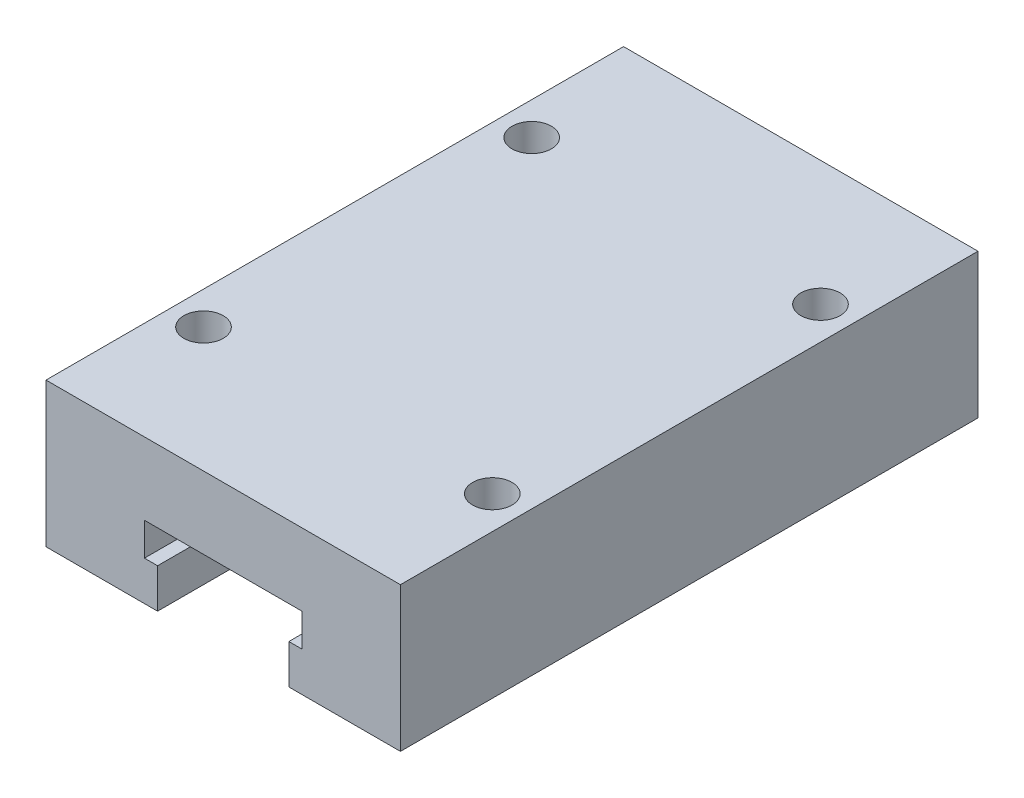
from build123d import *

# Parameters (mm, degrees)
BOSS_EXTRUDE1_DEPTH = 44
SKETCH2_R           = 1.5
CUT_EXTRUDE1_DEPTH  = 4


with BuildPart() as part:
    # Sketch1 → Boss-Extrude1 (new body)
    with BuildSketch(Plane.XY):
        Polygon((19.5, 5.5), (19.5, 3), (18.5, 3), (18.5, 0), (27, 0), (27, 11), (0, 11), (0, 0), (8.5, 0), (8.5, 3), (7.5, 3), (7.5, 5.5), align=None)
    extrude(amount=BOSS_EXTRUDE1_DEPTH)

    # Sketch2 → Cut-Extrude1 (cut)
    with BuildSketch(Plane(origin=(0, 11, 0), x_dir=(1, 0, 0), z_dir=(0, 1, 0))):
        with Locations((2.5, -9.5)):
            Circle(SKETCH2_R)
        with Locations((24.5, -9.5)):
            Circle(SKETCH2_R)
        with Locations((24.5, -34.5)):
            Circle(SKETCH2_R)
        with Locations((2.5, -34.5)):
            Circle(SKETCH2_R)
    extrude(amount=-CUT_EXTRUDE1_DEPTH, mode=Mode.SUBTRACT)


solid = part.part
